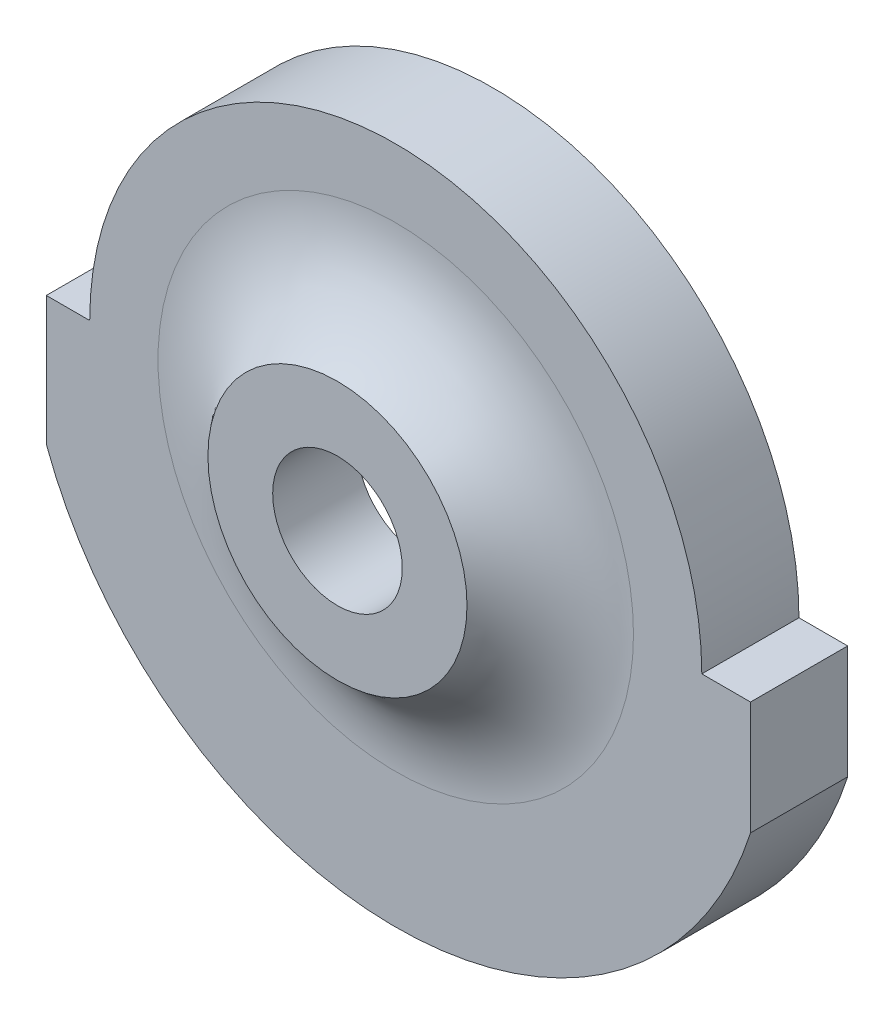
from build123d import *

# Parameters (mm, degrees)
BOSS_EXTRUDE1_DEPTH = 15.3
SKETCH2_R           = 9.3
CUT_EXTRUDE1_DEPTH  = 3.1
BOSS_EXTRUDE2_START = 8
BOSS_EXTRUDE2_DEPTH = 8
BOSS_EXTRUDE3_START = 3
SKETCH4_R           = 2
BOSS_EXTRUDE3_DEPTH = 3
BOSS_EXTRUDE4_START = 1.8
SKETCH5_R           = 4
SKETCH5_R_2         = 2
BOSS_EXTRUDE4_DEPTH = 1.8
FILLET1_R           = 4
FILLET2_R           = 1
CUT_EXTRUDE2_START  = -2.2
SKETCH7_R           = 2
CUT_EXTRUDE2_DEPTH  = 2.2
SKETCH9_R           = 21.205552102
CUT_EXTRUDE4_DEPTH  = 23.3
SKETCH8_W           = 42.45562683
SKETCH8_H           = 26.950518874
CUT_EXTRUDE5_DEPTH  = 21.71696165
CUT_EXTRUDE6_DEPTH  = 10


with BuildPart() as part:
    # Sketch1 → Boss-Extrude1 (new body)
    with BuildSketch(Plane.XY):
        with BuildLine():
            Line((-8.55, 0), (-16.55, 0))
            Line((-16.55, 0), (-16.55, 3.5))
            Line((-16.55, 3.5), (-10.95445115, 3.5))
            ThreePointArc((-10.95445115, 3.5), (0, 11.5), (10.95445115, 3.5))
            Line((10.95445115, 3.5), (16.55, 3.5))
            Line((16.55, 3.5), (16.55, 0))
            Line((16.55, 0), (8.55, 0))
            ThreePointArc((8.55, 0), (0, 8.55), (-8.55, 0))
        make_face()
    extrude(amount=-BOSS_EXTRUDE1_DEPTH)

    # Sketch2 → Cut-Extrude1 (cut)
    with BuildSketch(Plane.XY.offset(-6.3)):
        Circle(SKETCH2_R)
    extrude(amount=-CUT_EXTRUDE1_DEPTH, mode=Mode.SUBTRACT)

    # Sketch3 → Boss-Extrude2 (add)
    with BuildSketch(Plane.XY.offset(BOSS_EXTRUDE2_START)):
        with BuildLine():
            Line((-10.25, 0), (-16.55, 0))
            Line((-16.55, 0), (-16.55, 3.5))
            Line((-16.55, 3.5), (-10.95445115, 3.5))
            ThreePointArc((-10.95445115, 3.5), (0, 11.5), (10.95445115, 3.5))
            Line((10.95445115, 3.5), (16.55, 3.5))
            Line((16.55, 3.5), (16.55, 0))
            Line((16.55, 0), (10.25, 0))
            ThreePointArc((10.25, 0), (0, 10.25), (-10.25, 0))
        make_face()
    extrude(amount=-BOSS_EXTRUDE2_DEPTH)

    # Sketch4 → Boss-Extrude3 (add)
    with BuildSketch(Plane.XY.offset(8).offset(BOSS_EXTRUDE3_START)):
        with BuildLine():
            Line((-11.5, 0), (-16.55, 0))
            Line((-16.55, 0), (-16.55, 3.5))
            Line((-16.55, 3.5), (-10.95445115, 3.5))
            ThreePointArc((-10.95445115, 3.5), (0, 11.5), (10.95445115, 3.5))
            Line((10.95445115, 3.5), (16.55, 3.5))
            Line((16.55, 3.5), (16.55, 0))
            Line((16.55, 0), (11.5, 0))
            ThreePointArc((11.5, 0), (0, -11.5), (-11.5, 0))
        make_face()
        Circle(SKETCH4_R, mode=Mode.SUBTRACT)
    extrude(amount=-BOSS_EXTRUDE3_DEPTH)

    # Sketch5 → Boss-Extrude4 (add)
    with BuildSketch(Plane.XY.offset(11).offset(BOSS_EXTRUDE4_START)):
        Circle(SKETCH5_R)
        Circle(SKETCH5_R_2, mode=Mode.SUBTRACT)
    extrude(amount=-BOSS_EXTRUDE4_DEPTH)

    # Fillet1
    # the kernel refuses this fillet: 4 mm, written as the material it adds along each edge
    with BuildSketch(Plane(origin=(0, 0, 11), x_dir=(1, 0, 0), z_dir=(0, -1, 0))) as fillet1_piece_1:
        with BuildLine():
            CenterArc((7.340658618, 4), FILLET1_R, 213.367012969, 56.632987031)
            Line((7.340658618, 0), (7.340658618, -0.08))
            Line((7.340658618, -0.08), (4, -0.08))
            Line((4, -0.08), (3.92, 0))
            ThreePointArc((3.92, 0), (3.92, 0.9), (3.933186828, 1.756))
            Line((3.933186828, 1.756), (4, 1.8))
        make_face()
    revolve(axis=Axis((0, 0, 11), (0, 0, 1)))

    # Fillet2
    fillet2_edges = [part.edges().sort_by_distance(p)[0] for p in [
        (0, 10.25, 8),
    ]]
    fillet(fillet2_edges, radius=FILLET2_R)

    # Sketch7 → Cut-Extrude2 (cut)
    with BuildSketch(Plane(origin=(0, 0, 8), x_dir=(-1, 0, 0), z_dir=(0, 0, -1)).offset(CUT_EXTRUDE2_START)):
        Polygon((5.55, 2.65), (5.55, -6.55), (3.15, -6.55), (3.15, -10.55), (-3.15, -10.55), (-6.775322586, -10.55), (-8.767406073, -8.55), (-3.15, -8.55), (-3.15, -6.55), (-5.55, -6.55), (-5.55, 2.65), (-2.65, 5.55), (2.65, 5.55), align=None)
        Circle(SKETCH7_R, mode=Mode.SUBTRACT)
    extrude(amount=CUT_EXTRUDE2_DEPTH, mode=Mode.SUBTRACT)

    # Sketch9 → Cut-Extrude4 (cut)
    with BuildSketch(Plane(origin=(0, 0, 8), x_dir=(-1, 0, 0), z_dir=(0, 0, -1))):
        Circle(SKETCH9_R)
    extrude(amount=CUT_EXTRUDE4_DEPTH, mode=Mode.SUBTRACT)

    # Sketch8 → Cut-Extrude5 (cut, through all)
    with BuildSketch(Plane(origin=(0, 0, 8), x_dir=(-1, 0, 0), z_dir=(0, 0, -1))):
        Rectangle(SKETCH8_W, SKETCH8_H)
        with BuildLine():
            Line((11.5, 0), (9.45, 0))
            ThreePointArc((9.45, 0), (0, 9.45), (-9.45, 0))
            Line((-9.45, 0), (-11.5, 0))
            ThreePointArc((-11.5, 0), (0, -11.5), (11.5, 0))
        make_face(mode=Mode.SUBTRACT)
    extrude(amount=-CUT_EXTRUDE5_DEPTH, mode=Mode.SUBTRACT)

    # Sketch10 → Cut-Extrude6 (cut)
    with BuildSketch(Plane.XY.offset(11)):
        with BuildLine():
            Line((-10.789833042, 0), (-10.789833042, -3.978630786))
            ThreePointArc((-10.789833042, -3.978630786), (-11.321066204, -2.020757286), (-11.5, 0))
            Line((-11.5, 0), (-10.789833042, 0))
        make_face()
        with BuildLine():
            Line((10.95445115, 0), (10.95445115, -3.5))
            ThreePointArc((10.95445115, -3.5), (11.362794292, -1.771131245), (11.5, 0))
            Line((11.5, 0), (10.95445115, 0))
        make_face()
    extrude(amount=-CUT_EXTRUDE6_DEPTH, mode=Mode.SUBTRACT)


solid = part.part
